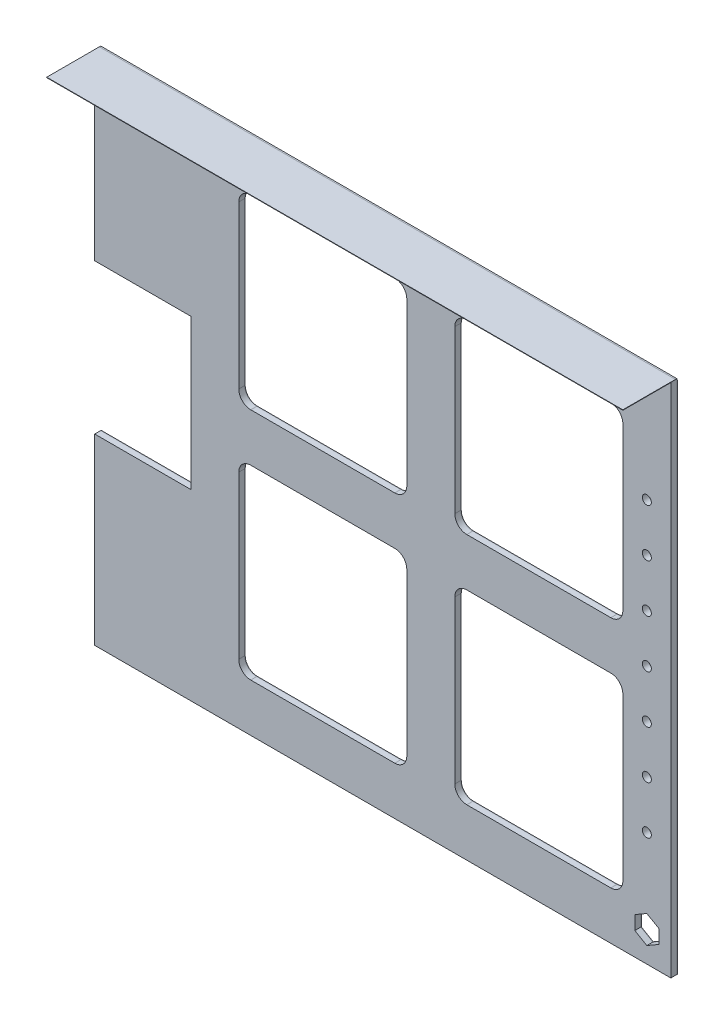
from build123d import *

# Parameters (mm, degrees)
SKETCH1_R                    = 2.3876
BOSS_EXTRUDE1_DEPTH          = 3.175
BASE_FLANGE1_START           = -0.2286
SKETCH1_2_R                  = 2.3876
BASE_FLANGE1_DEPTH           = 0.2286
EDGE_FLANGE1_STRIP_W         = 2.3876
EDGE_FLANGE1_STRIP_H         = 0.2286
EDGE_FLANGE1_STRIP_CUT_DEPTH = 304.8
EDGE_FLANGE1_DEPTH           = 304.8


# Sheet-metal steps are written as plain solids
with BuildPart() as part:
    # Sketch1 → Boss-Extrude1 (new body)
    with BuildSketch(Plane.XY):
        Polygon((0, 0), (304.8, 0), (304.8, 273.05), (0, 273.05), (0, 176.2125), (50.8, 176.2125), (50.8, 96.8375), (0, 96.8375), align=None)
        with Locations((292.1, 60.325)):
            Circle(SKETCH1_R, mode=Mode.SUBTRACT)
        with Locations((292.1, 85.725)):
            Circle(SKETCH1_R, mode=Mode.SUBTRACT)
        with Locations((292.1, 111.125)):
            Circle(SKETCH1_R, mode=Mode.SUBTRACT)
        with Locations((292.1, 136.525)):
            Circle(SKETCH1_R, mode=Mode.SUBTRACT)
        with Locations((292.1, 161.925)):
            Circle(SKETCH1_R, mode=Mode.SUBTRACT)
        with Locations((292.1, 187.325)):
            Circle(SKETCH1_R, mode=Mode.SUBTRACT)
        with Locations((292.1, 212.725)):
            Circle(SKETCH1_R, mode=Mode.SUBTRACT)
        with BuildLine():
            Line((196.85, 247.65), (273.05, 247.65))
            ThreePointArc((273.05, 247.65), (277.540128061, 245.790128061), (279.4, 241.3))
            Line((279.4, 241.3), (279.4, 155.575))
            ThreePointArc((279.4, 155.575), (277.540128061, 151.084871939), (273.05, 149.225))
            Line((273.05, 149.225), (196.85, 149.225))
            ThreePointArc((196.85, 149.225), (192.359871939, 151.084871939), (190.5, 155.575))
            Line((190.5, 155.575), (190.5, 241.3))
            ThreePointArc((190.5, 241.3), (192.359871939, 245.790128061), (196.85, 247.65))
        make_face(mode=Mode.SUBTRACT)
        with BuildLine():
            Line((76.2, 241.3), (76.2, 155.575))
            ThreePointArc((76.2, 155.575), (78.059871939, 151.084871939), (82.55, 149.225))
            Line((82.55, 149.225), (158.75, 149.225))
            ThreePointArc((158.75, 149.225), (163.240128061, 151.084871939), (165.1, 155.575))
            Line((165.1, 155.575), (165.1, 241.3))
            ThreePointArc((165.1, 241.3), (163.240128061, 245.790128061), (158.75, 247.65))
            Line((158.75, 247.65), (82.55, 247.65))
            ThreePointArc((82.55, 247.65), (78.059871939, 245.790128061), (76.2, 241.3))
        make_face(mode=Mode.SUBTRACT)
        with BuildLine():
            Line((158.75, 25.4), (82.55, 25.4))
            ThreePointArc((82.55, 25.4), (78.059871939, 27.259871939), (76.2, 31.75))
            Line((76.2, 31.75), (76.2, 117.475))
            ThreePointArc((76.2, 117.475), (78.059871939, 121.965128061), (82.55, 123.825))
            Line((82.55, 123.825), (158.75, 123.825))
            ThreePointArc((158.75, 123.825), (163.240128061, 121.965128061), (165.1, 117.475))
            Line((165.1, 117.475), (165.1, 31.75))
            ThreePointArc((165.1, 31.75), (163.240128061, 27.259871939), (158.75, 25.4))
        make_face(mode=Mode.SUBTRACT)
        with BuildLine():
            Line((279.4, 31.75), (279.4, 117.475))
            ThreePointArc((279.4, 117.475), (277.540128061, 121.965128061), (273.05, 123.825))
            Line((273.05, 123.825), (196.85, 123.825))
            ThreePointArc((196.85, 123.825), (192.359871939, 121.965128061), (190.5, 117.475))
            Line((190.5, 117.475), (190.5, 31.75))
            ThreePointArc((190.5, 31.75), (192.359871939, 27.259871939), (196.85, 25.4))
            Line((196.85, 25.4), (273.05, 25.4))
            ThreePointArc((273.05, 25.4), (277.540128061, 27.259871939), (279.4, 31.75))
        make_face(mode=Mode.SUBTRACT)
        Polygon((298.45, 12.200574209), (298.45, 19.532922628), (292.1, 23.199096837), (285.75, 19.532922628), (285.75, 12.200574209), (292.1, 8.5344), align=None, mode=Mode.SUBTRACT)
    extrude(amount=BOSS_EXTRUDE1_DEPTH)


with BuildPart() as body_2:
    # Sketch1<2> → Base-Flange1 (new body)
    with BuildSketch(Plane.XY.offset(BASE_FLANGE1_START)):
        Polygon((0, 0), (304.8, 0), (304.8, 273.05), (0, 273.05), (0, 176.2125), (50.8, 176.2125), (50.8, 96.8375), (0, 96.8375), align=None)
        with Locations((292.1, 60.325)):
            Circle(SKETCH1_2_R, mode=Mode.SUBTRACT)
        with Locations((292.1, 85.725)):
            Circle(SKETCH1_2_R, mode=Mode.SUBTRACT)
        with Locations((292.1, 111.125)):
            Circle(SKETCH1_2_R, mode=Mode.SUBTRACT)
        with Locations((292.1, 136.525)):
            Circle(SKETCH1_2_R, mode=Mode.SUBTRACT)
        with Locations((292.1, 161.925)):
            Circle(SKETCH1_2_R, mode=Mode.SUBTRACT)
        with Locations((292.1, 187.325)):
            Circle(SKETCH1_2_R, mode=Mode.SUBTRACT)
        with Locations((292.1, 212.725)):
            Circle(SKETCH1_2_R, mode=Mode.SUBTRACT)
        with BuildLine():
            Line((196.85, 247.65), (273.05, 247.65))
            ThreePointArc((273.05, 247.65), (277.540128061, 245.790128061), (279.4, 241.3))
            Line((279.4, 241.3), (279.4, 155.575))
            ThreePointArc((279.4, 155.575), (277.540128061, 151.084871939), (273.05, 149.225))
            Line((273.05, 149.225), (196.85, 149.225))
            ThreePointArc((196.85, 149.225), (192.359871939, 151.084871939), (190.5, 155.575))
            Line((190.5, 155.575), (190.5, 241.3))
            ThreePointArc((190.5, 241.3), (192.359871939, 245.790128061), (196.85, 247.65))
        make_face(mode=Mode.SUBTRACT)
        with BuildLine():
            Line((76.2, 241.3), (76.2, 155.575))
            ThreePointArc((76.2, 155.575), (78.059871939, 151.084871939), (82.55, 149.225))
            Line((82.55, 149.225), (158.75, 149.225))
            ThreePointArc((158.75, 149.225), (163.240128061, 151.084871939), (165.1, 155.575))
            Line((165.1, 155.575), (165.1, 241.3))
            ThreePointArc((165.1, 241.3), (163.240128061, 245.790128061), (158.75, 247.65))
            Line((158.75, 247.65), (82.55, 247.65))
            ThreePointArc((82.55, 247.65), (78.059871939, 245.790128061), (76.2, 241.3))
        make_face(mode=Mode.SUBTRACT)
        with BuildLine():
            Line((158.75, 25.4), (82.55, 25.4))
            ThreePointArc((82.55, 25.4), (78.059871939, 27.259871939), (76.2, 31.75))
            Line((76.2, 31.75), (76.2, 117.475))
            ThreePointArc((76.2, 117.475), (78.059871939, 121.965128061), (82.55, 123.825))
            Line((82.55, 123.825), (158.75, 123.825))
            ThreePointArc((158.75, 123.825), (163.240128061, 121.965128061), (165.1, 117.475))
            Line((165.1, 117.475), (165.1, 31.75))
            ThreePointArc((165.1, 31.75), (163.240128061, 27.259871939), (158.75, 25.4))
        make_face(mode=Mode.SUBTRACT)
        with BuildLine():
            Line((279.4, 31.75), (279.4, 117.475))
            ThreePointArc((279.4, 117.475), (277.540128061, 121.965128061), (273.05, 123.825))
            Line((273.05, 123.825), (196.85, 123.825))
            ThreePointArc((196.85, 123.825), (192.359871939, 121.965128061), (190.5, 117.475))
            Line((190.5, 117.475), (190.5, 31.75))
            ThreePointArc((190.5, 31.75), (192.359871939, 27.259871939), (196.85, 25.4))
            Line((196.85, 25.4), (273.05, 25.4))
            ThreePointArc((273.05, 25.4), (277.540128061, 27.259871939), (279.4, 31.75))
        make_face(mode=Mode.SUBTRACT)
        Polygon((298.45, 12.200574209), (298.45, 19.532922628), (292.1, 23.199096837), (285.75, 19.532922628), (285.75, 12.200574209), (292.1, 8.5344), align=None, mode=Mode.SUBTRACT)
    extrude(amount=BASE_FLANGE1_DEPTH)

    # Edge-Flange1 strip (across the edge) → Edge-Flange1 strip cut (cut)
    with BuildSketch(Plane(origin=(304.8, 273.05, 0), x_dir=(0, -1, 0), z_dir=(-1, 0, 0))):
        with Locations((-0.2286, -0.1143)):
            Rectangle(EDGE_FLANGE1_STRIP_W, EDGE_FLANGE1_STRIP_H)
    extrude(amount=EDGE_FLANGE1_STRIP_CUT_DEPTH, mode=Mode.SUBTRACT)

    # Edge-Flange1 section (across the edge) → Edge-Flange1 (add)
    with BuildSketch(Plane(origin=(304.8, 273.05, 0), x_dir=(0, -1, 0), z_dir=(-1, 0, 0))):
        with BuildLine():
            Line((0, 0.7366), (0, 28.575))
            Line((0, 28.575), (0.2286, 28.575))
            Line((0.2286, 28.575), (0.2286, 0.7366))
            ThreePointArc((0.2286, 0.7366), (0.444345145, 0.215745145), (0.9652, 0))
            Line((0.9652, 0), (0.9652, -0.2286))
            ThreePointArc((0.9652, -0.2286), (0.282700535, 0.054100535), (0, 0.7366))
        make_face()
    extrude(amount=EDGE_FLANGE1_DEPTH)


solid = Compound([part.part, body_2.part])
